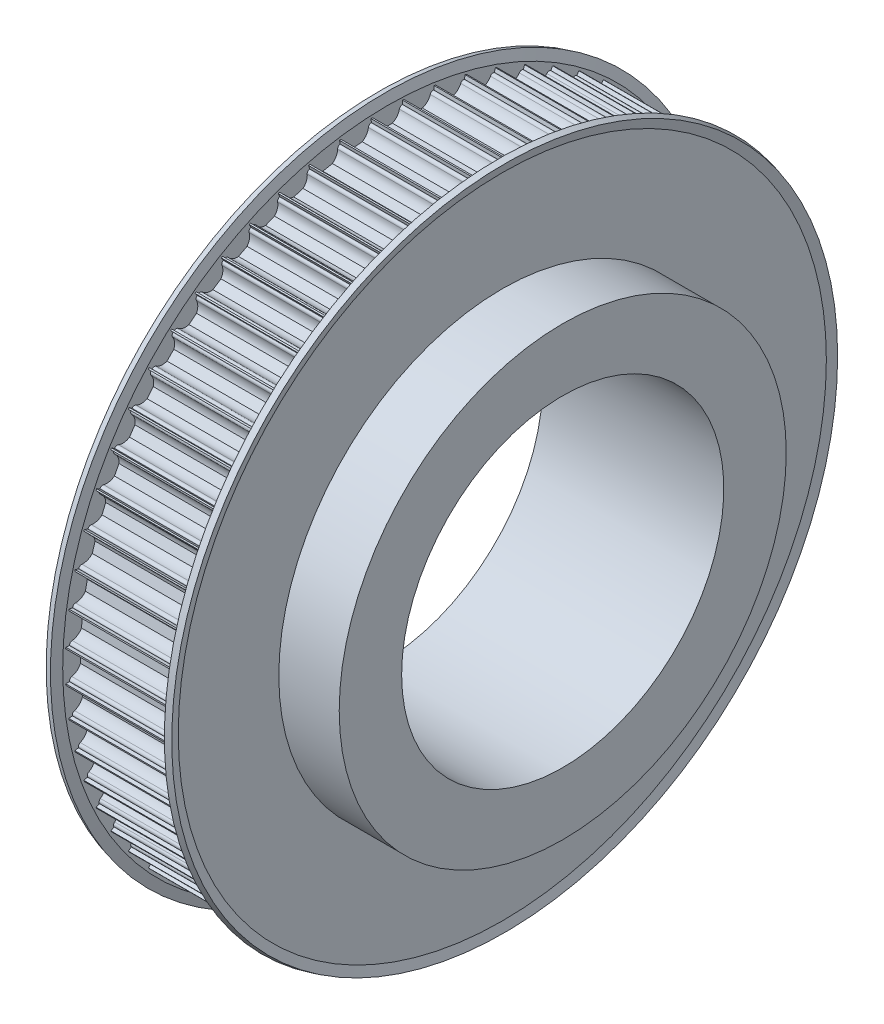
from build123d import *

# Parameters (mm, degrees)
CUT_EXTRUDE1_REACH = 123.758
CIRPATTERN1_COUNT  = 64


with BuildPart() as part:
    # Sketch1 → Revolve1 (revolve)
    with BuildSketch(Plane.XY):
        Polygon((0, 40), (45, 40), (45, 55.5), (30, 55.5), (30, 80), (0, 80), align=None)
    revolve(axis=Axis((-22.913888515, 0, 0), (1, 0, 0)))

    # Sketch2 → Cut-Extrude1 (cut, up to next)
    with BuildSketch(Plane.ZY, mode=Mode.PRIVATE) as cut_extrude1_sk1:
        with BuildLine():
            Line((3.674234614, 79), (3.75, 79))
            Line((3.75, 79), (3.75, 81))
            Line((3.75, 81), (-3.75, 81))
            Line((-3.75, 81), (-3.75, 79))
            Line((-3.75, 79), (-3.674234614, 79))
            ThreePointArc((-3.674234614, 79), (-3.199892965, 78.830947502), (-2.939387691, 78.4))
            ThreePointArc((-2.939387691, 78.4), (-2.331759211, 77.112435701), (-1.198957881, 76.25))
            Line((-1.198957881, 76.25), (1.198957881, 76.25))
            ThreePointArc((1.198957881, 76.25), (2.331759211, 77.112435701), (2.939387691, 78.4))
            ThreePointArc((2.939387691, 78.4), (3.199892965, 78.830947502), (3.674234614, 79))
        make_face()
    cut_extrude1_tool1 = extrude(cut_extrude1_sk1.sketch, amount=-CUT_EXTRUDE1_REACH, mode=Mode.PRIVATE) & part.part
    cut_extrude1 = cut_extrude1_tool1.solids().sort_by_distance((0, 78.935169, 0))[0]
    add(cut_extrude1, mode=Mode.SUBTRACT)

    # CirPattern1: Cut-Extrude1 ×64 about axis
    cirpattern1_axis = Axis((-22.913888515, 0, 0), (-1, 0, 0))
    for i in range(1, CIRPATTERN1_COUNT):
        add(cut_extrude1.rotate(cirpattern1_axis, i * 360 / CIRPATTERN1_COUNT), mode=Mode.SUBTRACT)

    # Sketch3 → Revolve2 (revolve)
    with BuildSketch(Plane.XY):
        Polygon((-0.591966801, 82.673832474), (0, 80.464582296), (0, 75.662061042), (1.5, 75.662061042), (1.5, 80.662061042), (0.856921938, 83.062061042), align=None)
        Polygon((30.591966801, 82.673832474), (29.143078062, 83.062061042), (28.5, 80.662061042), (28.5, 75.662061042), (30, 75.662061042), (30, 80.464582296), align=None)
    revolve(axis=Axis((-22.913888515, 0, 0), (-1, 0, 0)))


solid = part.part
